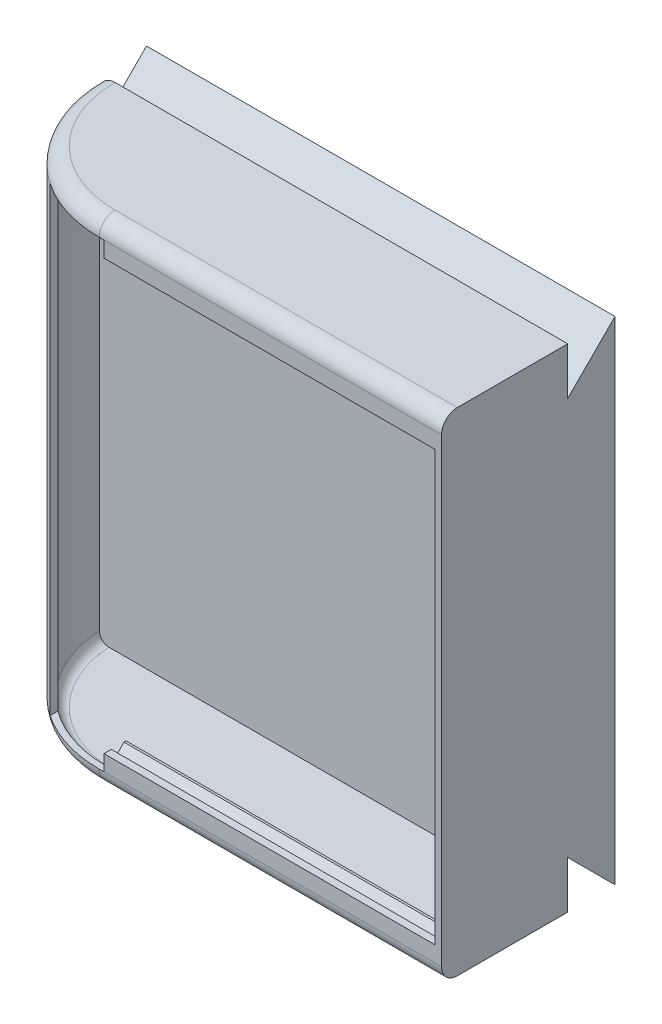
from build123d import *

# Parameters (mm, degrees)
SKETCH1_W            = 148.500856602
SKETCH1_H            = 156
BOSS_EXTRUDE1_DEPTH  = 40
FILLET3_R            = 40
FILLET4_R            = 5
SHELL4_T             = -2
SKETCH19_W           = 131
SKETCH19_H           = 146
CUT_EXTRUDE8_DEPTH   = 10
SKETCH21_W           = 107
SKETCH21_H           = 2
BOSS_EXTRUDE7_DEPTH  = 5
BOSS_EXTRUDE8_START  = -107
BOSS_EXTRUDE8_DEPTH  = 107
CUT_EXTRUDE9_DEPTH   = 107
BOSS_EXTRUDE9_DEPTH  = 2
BOSS_EXTRUDE10_DEPTH = 15
CUT_EXTRUDE10_DEPTH  = 170
SHELL5_START         = -57.680419874
SHELL5_DEPTH         = 103
SKETCH29_W           = 7.658063704
SKETCH29_H           = 119.773909492
CUT_EXTRUDE11_DEPTH  = 170
SKETCH31_W           = 7.658063704
SKETCH31_H           = 119.773909492
BOSS_EXTRUDE12_DEPTH = 2
SKETCH32_W           = 7.658063704
SKETCH32_H           = 119.773909492
BOSS_EXTRUDE13_DEPTH = 2


# Read off the part's stored shape, not the designer's step: Shell5
# Some blends are built 0.0001 mm under size
with BuildPart() as part:
    # Sketch1 → Boss-Extrude1 (new body)
    with BuildSketch(Plane.XY):
        with Locations((-26.930848175, -80)):
            Rectangle(SKETCH1_W, SKETCH1_H)
    extrude(amount=BOSS_EXTRUDE1_DEPTH)

    # Fillet3
    fillet3_edges = [part.edges().sort_by_distance(p)[0] for p in [
        (-101.181276476, -80, 40),
    ]]
    fillet(fillet3_edges, radius=FILLET3_R - 0.0001)  # a hair under: the kernel refuses the full size

    # Fillet4
    # the kernel refuses this fillet: 5 mm, written as the material it takes off along each edge
    with BuildSketch(Plane(origin=(-61.181376476, -158, 40), x_dir=(0, 1, 0), z_dir=(1, 0, 0))) as fillet4_piece_1:
        with BuildLine():
            CenterArc((FILLET4_R, -FILLET4_R), FILLET4_R, 90, 90)
            Line((0, -FILLET4_R), (0, 0))
            Line((0, 0), (FILLET4_R, 0))
        make_face()
    extrude(amount=121.000956602, mode=Mode.SUBTRACT)
    with BuildSketch(Plane(origin=(-61.181376476, -158, 0.0001), x_dir=(-1, 0, 0), z_dir=(0, 0, -1))) as fillet4_piece_2:
        with BuildLine():
            CenterArc((39.9999 - FILLET4_R, FILLET4_R), FILLET4_R, 270, 90)
            Line((39.9999 - FILLET4_R, 0), (39.9999, 0))
            Line((39.9999, 0), (39.9999, FILLET4_R))
        make_face()
    revolve(axis=Axis((-61.181376476, -158, 0.0001), (0, 1, 0)), revolution_arc=90, mode=Mode.SUBTRACT)
    with BuildSketch(Plane(origin=(-61.181376476, -2, 0.0001), x_dir=(-1, 0, 0), z_dir=(0, 0, -1))) as fillet4_piece_3:
        with BuildLine():
            CenterArc((39.9999 - FILLET4_R, -FILLET4_R), FILLET4_R, 0, 90)
            Line((39.9999, -FILLET4_R), (39.9999, 0))
            Line((39.9999, 0), (39.9999 - FILLET4_R, 0))
        make_face()
    revolve(axis=Axis((-61.181376476, -2, 0.0001), (0, 1, 0)), revolution_arc=90, mode=Mode.SUBTRACT)
    with BuildSketch(Plane(origin=(59.819580126, -2, 40), x_dir=(0, 0, -1), z_dir=(-1, 0, 0))) as fillet4_piece_4:
        with BuildLine():
            CenterArc((FILLET4_R, FILLET4_R), FILLET4_R, 180, 90)
            Line((0, FILLET4_R), (0, 0))
            Line((0, 0), (FILLET4_R, 0))
        make_face()
    extrude(amount=121.000956602, mode=Mode.SUBTRACT)
    with BuildSketch(Plane(origin=(-101.181276476, -2, -12.5), x_dir=(1, 0, 0), z_dir=(0, 0, 1)), Plane(origin=(-101.181276476, -158, -12.5), x_dir=(0, 1, 0), z_dir=(0, 0, 1))) as fillet4_piece_5:
        with BuildLine():
            CenterArc((FILLET4_R, -FILLET4_R), FILLET4_R, 90, 90)
            Line((0, -FILLET4_R), (0, 0))
            Line((0, 0), (FILLET4_R, 0))
        make_face()
    extrude(amount=12.5001, mode=Mode.SUBTRACT)

    # Shell4
    shell4_openings = [part.faces().sort_by_distance(p)[0] for p in [
        (47.319580126, -80, 19.967473228),
    ]]
    offset(amount=SHELL4_T, openings=shell4_openings)

    # Sketch19 → Cut-Extrude8 (cut)
    with BuildSketch(Plane.XY.offset(40)):
        with Locations((-18.180419874, -80)):
            Rectangle(SKETCH19_W, SKETCH19_H)
    extrude(amount=-CUT_EXTRUDE8_DEPTH, mode=Mode.SUBTRACT)

    # Sketch21 → Boss-Extrude7 (add)
    with BuildSketch(Plane(origin=(0, -153, 0), x_dir=(1, 0, 0), z_dir=(0, 1, 0))):
        with Locations((-6.180419874, -39)):
            Rectangle(SKETCH21_W, SKETCH21_H)
    boss_extrude7 = extrude(amount=BOSS_EXTRUDE7_DEPTH)

    # Sketch22 → Boss-Extrude8 (add)
    with BuildSketch(Plane(origin=(47.319580126, 0, 0), x_dir=(0, 0, -1), z_dir=(1, 0, 0)).offset(BOSS_EXTRUDE8_START)):
        with BuildLine():
            Line((-38, -148), (-33, -148))
            Line((-33, -148), (-33, -156))
            Line((-33, -156), (-35, -156))
            ThreePointArc((-35, -156), (-37.121320344, -155.121320344), (-38, -153))
            Line((-38, -153), (-38, -148))
        make_face()
    boss_extrude8 = extrude(amount=BOSS_EXTRUDE8_DEPTH)

    # Sketch23 → Cut-Extrude9 (cut)
    with BuildSketch(Plane(origin=(47.319580126, 0, 0), x_dir=(0, 0, -1), z_dir=(1, 0, 0))):
        Polygon((-37.667948512, -148), (-37.667948512, -152.05), (-33.667948512, -148), align=None)
    cut_extrude9 = extrude(amount=-CUT_EXTRUDE9_DEPTH, mode=Mode.SUBTRACT)

    # Mirror1: Boss-Extrude7, Boss-Extrude8, Cut-Extrude9 across plane
    add(boss_extrude7.mirror(Plane.ZX.offset(-80)))
    add(boss_extrude8.mirror(Plane.ZX.offset(-80)))
    add(cut_extrude9.mirror(Plane.ZX.offset(-80)), mode=Mode.SUBTRACT)

    # Sketch25 → Boss-Extrude9 (add)
    with BuildSketch(Plane(origin=(47.319580126, 0, 0), x_dir=(0, 0, -1), z_dir=(1, 0, 0))):
        Polygon((-40, -148), (-37.667948512, -148), (-37.667948512, -152.05), (-33.667948512, -148), (-33, -148), (-33, -156), (-2, -156), (-2, -4), (-33, -4), (-33, -12), (-33.667948512, -12), (-37.667948512, -7.95), (-37.667948512, -12), (-40, -12), align=None)
    extrude(amount=-BOSS_EXTRUDE9_DEPTH)

    # Sketch26 → Boss-Extrude10 (add)
    with BuildSketch(Plane(origin=(0, 0, 0), x_dir=(-1, 0, 0), z_dir=(0, 0, -1))):
        Polygon((101.181276476, -7), (101.181276476, -153), (101.181276476, -158), (96.181276476, -158), (-47.319580126, -158), (-47.319580126, -2), (96.181276476, -2), (101.181276476, -2), align=None)
    extrude(amount=BOSS_EXTRUDE10_DEPTH)

    # Sketch27 → Cut-Extrude10 (cut)
    with BuildSketch(Plane.ZY.offset(101.181276476)):
        Polygon((0, -2), (0, -17), (-15, -2), align=None)
        Polygon((0, -158), (0, -143), (-15, -158), align=None)
    extrude(amount=-CUT_EXTRUDE10_DEPTH, mode=Mode.SUBTRACT)

    # Shell5 outline → Shell5 (cut)
    with BuildSketch(Plane.YZ.offset(SHELL5_START)):
        with BuildLine():
            Line((-152.194861825, 35), (-154.69858558, 37.472813585))
            ThreePointArc((-154.69858558, 37.472813585), (-155.654784053, 36.397183463), (-156, 35))
            Line((-156, 35), (-152.194861825, 35))
        make_face()
    extrude(amount=SHELL5_DEPTH, mode=Mode.SUBTRACT)

    # Sketch29 → Cut-Extrude11 (cut)
    with BuildSketch(Plane.ZY.offset(101.181276476)):
        with Locations((-8.13310084, -80.031899357)):
            Rectangle(SKETCH29_W, SKETCH29_H)
    extrude(amount=-CUT_EXTRUDE11_DEPTH, mode=Mode.SUBTRACT)

    # Sketch31 → Boss-Extrude12 (add)
    with BuildSketch(Plane(origin=(47.319580126, 0, 0), x_dir=(0, 0, -1), z_dir=(1, 0, 0))):
        with Locations((8.13310084, -80.031899357)):
            Rectangle(SKETCH31_W, SKETCH31_H)
    extrude(amount=-BOSS_EXTRUDE12_DEPTH)

    # Sketch32 → Boss-Extrude13 (add)
    with BuildSketch(Plane.ZY.offset(101.181276476)):
        with Locations((-8.13310084, -80.031899357)):
            Rectangle(SKETCH32_W, SKETCH32_H)
    extrude(amount=-BOSS_EXTRUDE13_DEPTH)


solid = part.part
